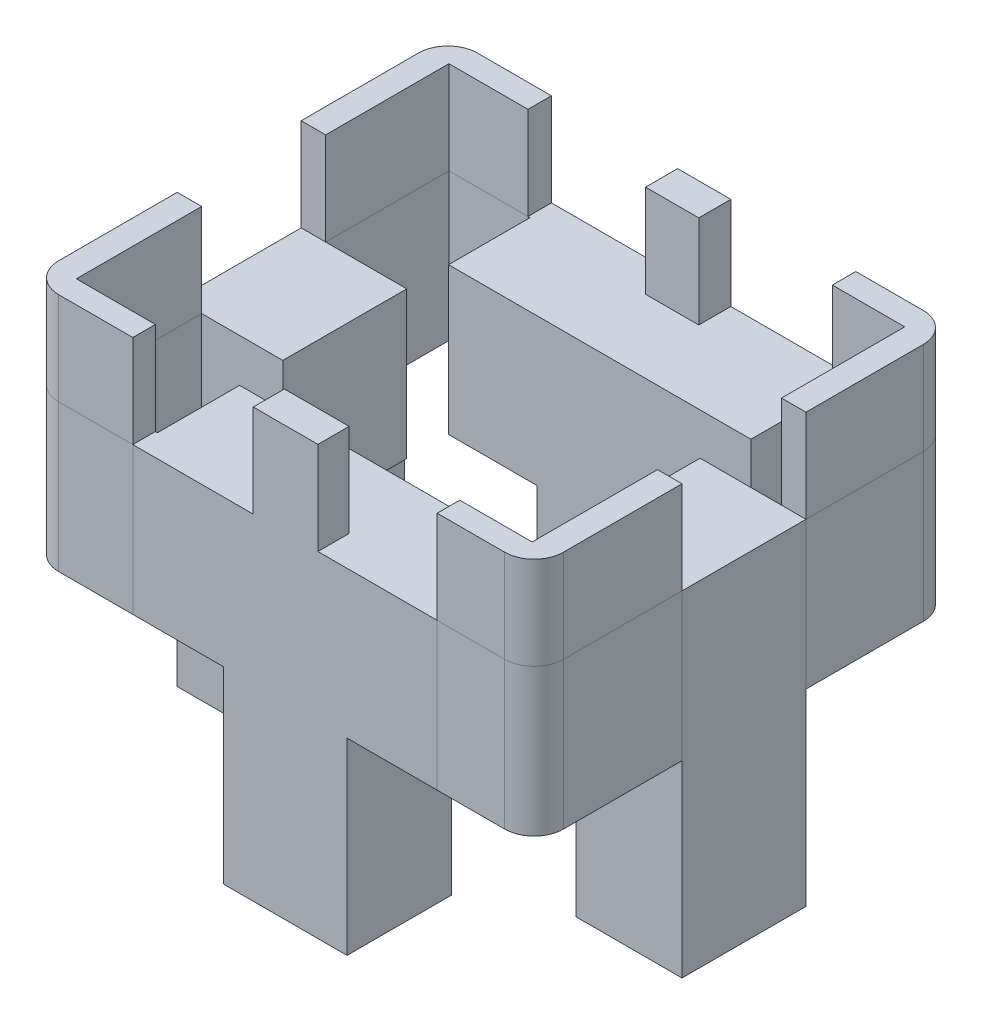
from build123d import *

# Parameters (mm, degrees)
BOSS_EXTRUDE1_DEPTH        = 4.00685
BOSS_EXTRUDE1_DEPTH_BACK   = 4.00685
SKETCH2_W                  = 4.5974
SKETCH2_H                  = 2.7686
BOSS_EXTRUDE1_2_DEPTH      = 4.00685
BOSS_EXTRUDE1_2_DEPTH_BACK = 4.00685
BOSS_EXTRUDE1_3_DEPTH      = 4.00685
BOSS_EXTRUDE1_3_DEPTH_BACK = 4.00685
BOSS_EXTRUDE1_4_DEPTH      = 4.00685
BOSS_EXTRUDE1_4_DEPTH_BACK = 4.00685
SKETCH2_W_2                = 5.588
SKETCH2_H_2                = 2.6924
BOSS_EXTRUDE1_5_DEPTH      = 4.00685
BOSS_EXTRUDE1_5_DEPTH_BACK = 4.00685
BOSS_EXTRUDE1_6_DEPTH      = 4.00685
BOSS_EXTRUDE1_6_DEPTH_BACK = 4.00685
SKETCH3_W                  = 9.1186
SKETCH3_H                  = 10.7061
BOSS_EXTRUDE2_DEPTH        = 28.956
BOSS_EXTRUDE4_DEPTH        = 12.7
BOSS_EXTRUDE4_2_DEPTH      = 12.7
BOSS_EXTRUDE4_3_DEPTH      = 12.7
BOSS_EXTRUDE4_4_DEPTH      = 12.7
CUT_EXTRUDE4_DEPTH         = 44.473891524
CUT_EXTRUDE4_DEPTH_BACK    = 44.473891524
SKETCH6_W                  = 6.25405
SKETCH6_H                  = 10.64895
SKETCH6_W_2                = 7.00405
SKETCH6_H_2                = 10.82675
CUT_EXTRUDE5_START         = -36.1569
CUT_EXTRUDE5_OUTLINE_W     = 7.8366
CUT_EXTRUDE5_OUTLINE_H     = 16.256
CUT_EXTRUDE5_DEPTH         = 36.1569
CUT_EXTRUDE5_2_OUTLINE_W   = 7.7858
CUT_EXTRUDE5_2_OUTLINE_H   = 16.256
CUT_EXTRUDE5_2_DEPTH       = 9.063080747
CUT_EXTRUDE5_START_2       = -9.0424
CUT_EXTRUDE5_3_OUTLINE_W   = 7.7858
CUT_EXTRUDE5_3_OUTLINE_H   = 16.256
CUT_EXTRUDE5_3_DEPTH       = 9.0424
SKETCH9_W                  = 2.02565
SKETCH9_H                  = 16.256
CUT_EXTRUDE6_DEPTH         = 3.556
FILLET2_R                  = 2.54
FILLET3_R                  = 2.54
FILLET4_R                  = 2.54
FILLET5_R                  = 2.54
FILLET6_R                  = 2.54
FILLET7_R                  = 2.54
FILLET8_R                  = 2.54
FILLET9_R                  = 2.54
SKETCH10_R                 = 1.2954
CUT_EXTRUDE7_DEPTH         = 6.35


# Read off the part's stored shape, not the designer's step: Cut-Extrude5
with BuildPart() as part:
    # Sketch2 → Boss-Extrude1 (new, two sides: drawn at the far end of the back side and taken through both)
    with BuildSketch(Plane(origin=(0, 0, 0), x_dir=(1, 0, 0), z_dir=(0, 1, 0)).offset(-BOSS_EXTRUDE1_DEPTH_BACK)):
        with Locations((0.33655, 16.73225)):
            Rectangle(SKETCH2_W, SKETCH2_H)
    extrude(amount=BOSS_EXTRUDE1_DEPTH + BOSS_EXTRUDE1_DEPTH_BACK)


with BuildPart() as body_2:
    # Sketch2 → Boss-Extrude1 2 (new, two sides: drawn at the far end of the back side and taken through both)
    with BuildSketch(Plane(origin=(0, 0, 0), x_dir=(1, 0, 0), z_dir=(0, 1, 0)).offset(-BOSS_EXTRUDE1_2_DEPTH_BACK)):
        Polygon((13.43095, 15.34795), (19.03095, 15.34795), (19.03095, 5.44195), (21.79955, 5.44195), (21.79955, 15.34795), (21.79955, 18.11655), (19.03095, 18.11655), (13.43095, 18.11655), align=None)
    extrude(amount=BOSS_EXTRUDE1_2_DEPTH + BOSS_EXTRUDE1_2_DEPTH_BACK)


    add(part.part)  # Boss-Extrude2 merges part


with BuildPart() as body_3:
    # Sketch2 → Boss-Extrude1 3 (new, two sides: drawn at the far end of the back side and taken through both)
    with BuildSketch(Plane(origin=(0, 0, 0), x_dir=(1, 0, 0), z_dir=(0, 1, 0)).offset(-BOSS_EXTRUDE1_3_DEPTH_BACK)):
        Polygon((-19.03095, -15.34795), (-12.85945, -15.34795), (-12.85945, -18.04035), (-19.03095, -18.04035), (-21.79955, -18.04035), (-21.79955, -15.34795), (-21.79955, -5.26415), (-19.03095, -5.26415), align=None)
    extrude(amount=BOSS_EXTRUDE1_3_DEPTH + BOSS_EXTRUDE1_3_DEPTH_BACK)


with BuildPart() as body_4:
    # Sketch2 → Boss-Extrude1 4 (new, two sides: drawn at the far end of the back side and taken through both)
    with BuildSketch(Plane(origin=(0, 0, 0), x_dir=(1, 0, 0), z_dir=(0, 1, 0)).offset(-BOSS_EXTRUDE1_4_DEPTH_BACK)):
        with Locations((0.33655, -16.69415)):
            Rectangle(SKETCH2_W_2, SKETCH2_H_2)
    extrude(amount=BOSS_EXTRUDE1_4_DEPTH + BOSS_EXTRUDE1_4_DEPTH_BACK)


with BuildPart() as body_5:
    # Sketch2 → Boss-Extrude1 5 (new, two sides: drawn at the far end of the back side and taken through both)
    with BuildSketch(Plane(origin=(0, 0, 0), x_dir=(1, 0, 0), z_dir=(0, 1, 0)).offset(-BOSS_EXTRUDE1_5_DEPTH_BACK)):
        Polygon((13.43095, -15.34795), (19.03095, -15.34795), (19.03095, -5.26415), (21.79955, -5.26415), (21.79955, -15.34795), (21.79955, -18.04035), (19.03095, -18.04035), (13.43095, -18.04035), align=None)
    extrude(amount=BOSS_EXTRUDE1_5_DEPTH + BOSS_EXTRUDE1_5_DEPTH_BACK)


with BuildPart() as body_6:
    # Sketch2 → Boss-Extrude1 6 (new, two sides: drawn at the far end of the back side and taken through both)
    with BuildSketch(Plane(origin=(0, 0, 0), x_dir=(1, 0, 0), z_dir=(0, 1, 0)).offset(-BOSS_EXTRUDE1_6_DEPTH_BACK)):
        Polygon((-12.85945, 15.34795), (-19.03095, 15.34795), (-19.03095, 5.44195), (-21.79955, 5.44195), (-21.79955, 15.34795), (-21.79955, 18.11655), (-19.03095, 18.11655), (-12.85945, 18.11655), align=None)
    extrude(amount=BOSS_EXTRUDE1_6_DEPTH + BOSS_EXTRUDE1_6_DEPTH_BACK)


with BuildPart() as body_2_1:
    add(body_2.part)

    add(body_4.part)  # Boss-Extrude2 merges body 4
    # Sketch3 → Boss-Extrude2 (add)
    with BuildSketch(Plane.XZ.offset(4.00685)):
        Polygon((13.43095, 18.04035), (-12.85945, 18.04035), (-12.85945, 8.99795), (13.43095, 8.99795), (13.43095, 15.34795), align=None)
        with Locations((-17.24025, -0.0889)):
            Rectangle(SKETCH3_W, SKETCH3_H)
        Polygon((-12.85945, -9.053469253), (-12.85945, -11.76655), (-12.85945, -18.11655), (13.536228167, -18.11655), (13.536228167, -9.053469253), align=None)
        Polygon((12.65555, -5.44195), (21.79955, -5.44195), (21.79955, 5.26415), (19.03095, 5.26415), (12.65555, 5.26415), align=None)
    extrude(amount=BOSS_EXTRUDE2_DEPTH)


with BuildPart() as body_5_2:
    # Sketch5 → Boss-Extrude4 (new body)
    with BuildSketch(Plane.XZ.offset(4.00685)):
        Polygon((-21.79955, 5.26415), (-21.79955, 18.04035), (-12.85945, 18.04035), (-12.85945, 15.34795), (-19.03095, 15.34795), (-19.03095, 5.26415), align=None)
    extrude(amount=BOSS_EXTRUDE4_DEPTH)


with BuildPart() as body_6_2:
    # Sketch5 → Boss-Extrude4 2 (new body)
    with BuildSketch(Plane.XZ.offset(4.00685)):
        Polygon((-21.79955, -5.44195), (-19.03095, -5.44195), (-19.03095, -15.34795), (-12.85945, -15.34795), (-12.85945, -18.11655), (-21.79955, -18.11655), align=None)
    extrude(amount=BOSS_EXTRUDE4_2_DEPTH)


with BuildPart() as body_7:
    # Sketch5 → Boss-Extrude4 3 (new body)
    with BuildSketch(Plane.XZ.offset(4.00685)):
        Polygon((13.43095, 18.04035), (21.79955, 18.04035), (21.79955, 5.26415), (19.03095, 5.26415), (19.03095, 15.34795), (13.43095, 15.34795), align=None)
    extrude(amount=BOSS_EXTRUDE4_3_DEPTH)


with BuildPart() as body_8:
    # Sketch5 → Boss-Extrude4 4 (new body)
    with BuildSketch(Plane.XZ.offset(4.00685)):
        Polygon((17.22755, -5.44195), (21.79955, -5.44195), (21.79955, -18.11655), (13.536228167, -18.11655), (13.536228167, -15.34795), (19.03095, -15.34795), align=None)
    extrude(amount=BOSS_EXTRUDE4_4_DEPTH)


with BuildPart() as cut_extrude4_tool:
    # Sketch6 → Cut-Extrude4 (new, two sides: drawn at the far end of the back side and taken through both)
    with BuildSketch(Plane(origin=(0, 0, 0), x_dir=(1, 0, 0), z_dir=(0, 1, 0)).offset(-CUT_EXTRUDE4_DEPTH_BACK)):
        with Locations((16.557975, 10.766425)):
            Rectangle(SKETCH6_W, SKETCH6_H)
        with Locations((-16.182975, 10.766425)):
            Rectangle(SKETCH6_W_2, SKETCH6_H)
        with Locations((-16.182975, -10.677525)):
            Rectangle(SKETCH6_W_2, SKETCH6_H_2)
        with Locations((16.557975, -10.677525)):
            Rectangle(SKETCH6_W, SKETCH6_H_2)
    extrude(amount=CUT_EXTRUDE4_DEPTH + CUT_EXTRUDE4_DEPTH_BACK)


with BuildPart() as body_2_2:
    add(body_2_1.part)

    # Cut-Extrude4: cut by cut_extrude4_tool
    add(cut_extrude4_tool.part, mode=Mode.SUBTRACT)

    # Cut-Extrude5 outline → Cut-Extrude5 (cut)
    with BuildSketch(Plane.XY.offset(18.04035).offset(CUT_EXTRUDE5_START)):
        with Locations((-8.94115, -24.83485)):
            Rectangle(CUT_EXTRUDE5_OUTLINE_W, CUT_EXTRUDE5_OUTLINE_H)
    extrude(amount=CUT_EXTRUDE5_DEPTH, mode=Mode.SUBTRACT)

    # Cut-Extrude5 2 outline → Cut-Extrude5 2 (cut)
    with BuildSketch(Plane.XY.offset(18.04035).offset(CUT_EXTRUDE5_START)):
        with Locations((9.53805, -24.83485)):
            Rectangle(CUT_EXTRUDE5_2_OUTLINE_W, CUT_EXTRUDE5_2_OUTLINE_H)
    extrude(amount=CUT_EXTRUDE5_2_DEPTH, mode=Mode.SUBTRACT)

    # Cut-Extrude5 3 outline → Cut-Extrude5 3 (cut)
    with BuildSketch(Plane.XY.offset(18.04035).offset(CUT_EXTRUDE5_START_2)):
        with Locations((9.53805, -24.83485)):
            Rectangle(CUT_EXTRUDE5_3_OUTLINE_W, CUT_EXTRUDE5_3_OUTLINE_H)
    extrude(amount=CUT_EXTRUDE5_3_DEPTH, mode=Mode.SUBTRACT)

    # Sketch9 → Cut-Extrude6 (cut)
    with BuildSketch(Plane(origin=(13.536228167, 0, 0), x_dir=(0, 0, -1), z_dir=(1, 0, 0))):
        with Locations((17.103725, -24.83485)):
            Rectangle(SKETCH9_W, SKETCH9_H)
    extrude(amount=-CUT_EXTRUDE6_DEPTH, mode=Mode.SUBTRACT)

    # Fillet4
    fillet4_edges = [body_2_2.edges().sort_by_distance(p)[0] for p in [
        (21.79955, 0, -18.11655),
    ]]
    fillet(fillet4_edges, radius=FILLET4_R)

    # Sketch10 → Cut-Extrude7 (cut)
    with BuildSketch(Plane.XZ.offset(32.96285)):
        with Locations(Location((-17.24025, -0.0889, 0), (0, 0, 270))):
            Circle(SKETCH10_R)
        with Locations(Location((17.30375, -0.0889, 0), (0, 0, 270))):
            Circle(SKETCH10_R)
        with Locations(Location((0.03175, 13.6271, 0), (0, 0, 270))):
            Circle(SKETCH10_R)
        with Locations(Location((0.03175, -13.8049, 0), (0, 0, 270))):
            Circle(SKETCH10_R)
    extrude(amount=-CUT_EXTRUDE7_DEPTH, mode=Mode.SUBTRACT)


with BuildPart() as body_3_1:
    add(body_3.part)

    # Cut-Extrude4: cut by cut_extrude4_tool
    add(cut_extrude4_tool.part, mode=Mode.SUBTRACT)

    # Fillet6
    fillet6_edges = [body_3_1.edges().sort_by_distance(p)[0] for p in [
        (-21.79955, 0, 18.04035),
    ]]
    fillet(fillet6_edges, radius=FILLET6_R)


with BuildPart() as body_5_1:
    add(body_5.part)

    # Cut-Extrude4: cut by cut_extrude4_tool
    add(cut_extrude4_tool.part, mode=Mode.SUBTRACT)

    # Fillet9
    fillet9_edges = [body_5_1.edges().sort_by_distance(p)[0] for p in [
        (21.79955, 0, 18.04035),
    ]]
    fillet(fillet9_edges, radius=FILLET9_R)


with BuildPart() as body_6_1:
    add(body_6.part)

    # Cut-Extrude4: cut by cut_extrude4_tool
    add(cut_extrude4_tool.part, mode=Mode.SUBTRACT)

    # Fillet3
    fillet3_edges = [body_6_1.edges().sort_by_distance(p)[0] for p in [
        (-21.79955, 0, -18.11655),
    ]]
    fillet(fillet3_edges, radius=FILLET3_R)


with BuildPart() as body_5_2_1:
    add(body_5_2.part)

    # Cut-Extrude4: cut by cut_extrude4_tool
    add(cut_extrude4_tool.part, mode=Mode.SUBTRACT)

    # Fillet7
    fillet7_edges = [body_5_2_1.edges().sort_by_distance(p)[0] for p in [
        (-21.79955, -10.35685, 18.04035),
    ]]
    fillet(fillet7_edges, radius=FILLET7_R)


with BuildPart() as body_6_2_1:
    add(body_6_2.part)

    # Cut-Extrude4: cut by cut_extrude4_tool
    add(cut_extrude4_tool.part, mode=Mode.SUBTRACT)

    # Fillet2
    fillet2_edges = [body_6_2_1.edges().sort_by_distance(p)[0] for p in [
        (-21.79955, -10.35685, -18.11655),
    ]]
    fillet(fillet2_edges, radius=FILLET2_R)


with BuildPart() as body_7_1:
    add(body_7.part)

    # Cut-Extrude4: cut by cut_extrude4_tool
    add(cut_extrude4_tool.part, mode=Mode.SUBTRACT)

    # Fillet8
    fillet8_edges = [body_7_1.edges().sort_by_distance(p)[0] for p in [
        (21.79955, -10.35685, 18.04035),
    ]]
    fillet(fillet8_edges, radius=FILLET8_R)


with BuildPart() as body_8_1:
    add(body_8.part)

    # Cut-Extrude4: cut by cut_extrude4_tool
    add(cut_extrude4_tool.part, mode=Mode.SUBTRACT)

    # Fillet5
    fillet5_edges = [body_8_1.edges().sort_by_distance(p)[0] for p in [
        (21.79955, -10.35685, -18.11655),
    ]]
    fillet(fillet5_edges, radius=FILLET5_R)


solid = Compound([body_2_2.part, body_3_1.part, body_5_1.part, body_6_1.part, body_5_2_1.part, body_6_2_1.part, body_7_1.part, body_8_1.part])
